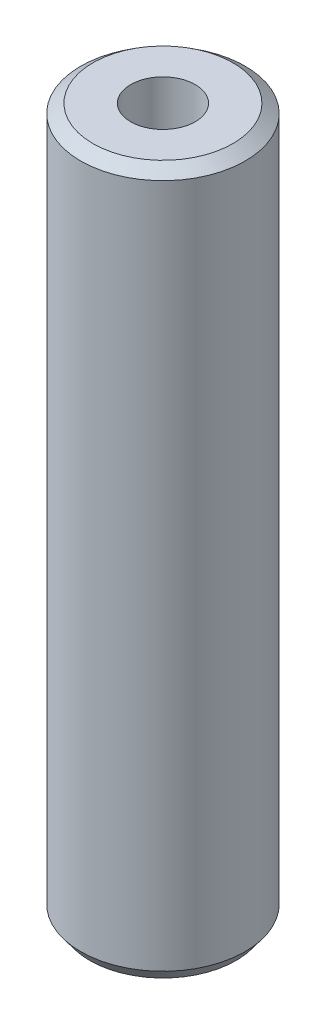
from build123d import *
from OCP.BRepFilletAPI import BRepFilletAPI_MakeChamfer

# Parameters (mm, degrees)
SKETCH1_R           = 30
BOSS_EXTRUDE1_DEPTH = 257.55234102
SKETCH2_R           = 11.769332606
CUT_EXTRUDE1_DEPTH  = 262.023386624
CHAMFER1_SIZE       = 3.287199673
CHAMFER1_SIZE2      = 4.451520904


with BuildPart() as part:
    # Sketch1 → Boss-Extrude1 (new body)
    with BuildSketch(Plane(origin=(0, 0, 0), x_dir=(1, 0, 0), z_dir=(0, 1, 0))):
        Circle(SKETCH1_R)
    extrude(amount=BOSS_EXTRUDE1_DEPTH)

    # Sketch2 → Cut-Extrude1 (cut, through all)
    with BuildSketch(Plane(origin=(0, 0, 0), x_dir=(1, 0, 0), z_dir=(0, 1, 0))):
        Circle(SKETCH2_R)
    extrude(amount=CUT_EXTRUDE1_DEPTH, mode=Mode.SUBTRACT)

    # Chamfer1: one chamfer whose edges measure the first distance from different faces: ONE call of the kernel's chamfer builder (chamfer() names one face for all edges)
    chamfer1_edges_1 = [part.edges().sort_by_distance(p)[0] for p in [
        (-30, 257.55234102, 0),
    ]]
    chamfer1_side_1 = [part.faces().sort_by_distance(p)[0] for p in [
        (-30, 128.77617051, 0),
    ]]
    chamfer1_edges_2 = [part.edges().sort_by_distance(p)[0] for p in [
        (-30, 0, 0),
    ]]
    chamfer1_side_2 = [part.faces().sort_by_distance(p)[0] for p in [
        (-29.151471863, 0, 0),
    ]]
    chamfer1 = BRepFilletAPI_MakeChamfer(part.part.solid().wrapped)
    for e in chamfer1_edges_1:
        chamfer1.Add(CHAMFER1_SIZE, CHAMFER1_SIZE2, e.wrapped, chamfer1_side_1[0].wrapped)  # the first distance lies on this face
    for e in chamfer1_edges_2:
        chamfer1.Add(CHAMFER1_SIZE, CHAMFER1_SIZE2, e.wrapped, chamfer1_side_2[0].wrapped)  # the first distance lies on this face
    add(Compound.cast(chamfer1.Shape()), mode=Mode.REPLACE)


solid = part.part
